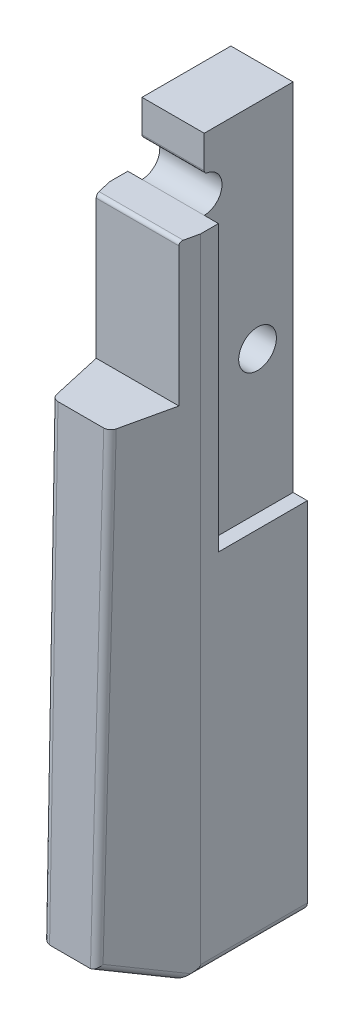
from build123d import *

# Parameters (mm, degrees)
SKETCH1_W           = 100
SKETCH1_H           = 11.75
BOSS_EXTRUDE1_DEPTH = 17.5
SKETCH5_R           = 2.65
CUT_EXTRUDE2_DEPTH  = 103.197419243
SKETCH4_W           = 50
SKETCH4_H           = 12.5
SKETCH4_R           = 2.65
CUT_EXTRUDE3_DEPTH  = 1.5
BOSS_EXTRUDE3_DEPTH = 0.5
BOSS_EXTRUDE2_DEPTH = 12.75
CUT_EXTRUDE4_DEPTH  = 105.302744451
FILLET4_R           = 1
FILLET3_R           = 1
CUT_EXTRUDE5_REACH  = 100.641
CUT_EXTRUDE7_REACH  = 106.363
SKETCH13_W          = 5
SKETCH13_H          = 5
FILLET5_R           = 0.5
CUT_EXTRUDE6_DEPTH  = 5
CHAMFER1_SIZE       = 3
CHAMFER1_SIZE2      = 0.262465991
FILLET6_R           = 1


with BuildPart() as part:
    # Sketch1 → Boss-Extrude1 (new body)
    with BuildSketch(Plane(origin=(0, 0, 0), x_dir=(0, 1, 0), z_dir=(0, 0, 1))):
        with Locations((50, 5.875)):
            Rectangle(SKETCH1_W, SKETCH1_H)
    extrude(amount=BOSS_EXTRUDE1_DEPTH)

    # Sketch5 → Cut-Extrude2 (cut, through all)
    with BuildSketch(Plane.YZ):
        with Locations(Location((70, 5, 0), (0, 0, 270))):
            Circle(SKETCH5_R)
    extrude(amount=-CUT_EXTRUDE2_DEPTH, mode=Mode.SUBTRACT)

    # Sketch4 → Cut-Extrude3 (cut)
    with BuildSketch(Plane.YZ):
        with Locations((75, 6.25)):
            Rectangle(SKETCH4_W, SKETCH4_H)
        with Locations(Location((70, 5, 0), (0, 0, 270))):
            Circle(SKETCH4_R, mode=Mode.SUBTRACT)
    cut_extrude3 = extrude(amount=-CUT_EXTRUDE3_DEPTH, mode=Mode.SUBTRACT)

    # Mirror1: Cut-Extrude3 across plane
    add(cut_extrude3.mirror(Plane(origin=(-5.875, 0, 0), x_dir=(0, 0, 1), z_dir=(1, 0, 0))), mode=Mode.SUBTRACT)

    # Sketch9 → Boss-Extrude3 (add)
    with BuildSketch(Plane.YZ):
        Polygon((0, 17.5), (50, 17.5), (100, 17.5), (100, 12.5), (50, 12.5), (50, 0), (0, 0), align=None)
    boss_extrude3 = extrude(amount=BOSS_EXTRUDE3_DEPTH)

    # Mirror4: Boss-Extrude3 across plane
    add(boss_extrude3.mirror(Plane(origin=(-5.875, 0, 0), x_dir=(0, 0, 1), z_dir=(1, 0, 0))))

    # Sketch6 → Boss-Extrude2 (add)
    with BuildSketch(Plane.YZ.offset(0.5)):
        Polygon((4.75, 27), (0, 17.5), (70, 17.5), (70, 25.469208211), align=None)
    extrude(amount=-BOSS_EXTRUDE2_DEPTH)

    # Sketch7 → Cut-Extrude4 (cut, symmetric)
    with BuildSketch(Plane(origin=(0, 100, 0), x_dir=(-1, 0, 0), z_dir=(0, 1, 0))):
        Polygon((-15.35357036, -50.966517558), (-0.5, 15), (2.202019917, 27), (17.055590277, 92.966517558), (-114.877444838, 122.673658277), (-147.286605475, -21.259376838), align=None)
    cut_extrude4 = extrude(amount=CUT_EXTRUDE4_DEPTH, both=True, mode=Mode.SUBTRACT)

    # Mirror3: Cut-Extrude4 across plane
    add(cut_extrude4.mirror(Plane(origin=(-5.875, 0, 0), x_dir=(0, 0, 1), z_dir=(1, 0, 0))), mode=Mode.SUBTRACT)

    # Fillet4
    fillet4_edges = [part.edges().sort_by_distance(p)[0] for p in [
        (-2.029677005, 37.375, 26.234604106),
        (-1.132470367, 2.375, 22.25),
        (-5.875, 0, 17.5),
        (-9.720322995, 37.375, 26.234604106),
        (-10.617529633, 2.375, 22.25),
    ]]
    fillet(fillet4_edges, radius=FILLET4_R)

    # Fillet3
    # the kernel refuses this fillet: 1 mm, written as the material it takes off along each edge
    with BuildSketch(Plane(origin=(-12.25, 0, -2.5), x_dir=(1, 0, 0), z_dir=(0, 0, 1))) as fillet3_piece_1:
        with BuildLine():
            CenterArc((FILLET3_R, FILLET3_R), FILLET3_R, 180, 90)
            Line((0, FILLET3_R), (0, 0))
            Line((0, 0), (FILLET3_R, 0))
        make_face()
    extrude(amount=20, mode=Mode.SUBTRACT)
    with BuildSketch(Plane(origin=(0.5, 0, -2.5), x_dir=(-1, 0, 0), z_dir=(0, 0, 1))) as fillet3_piece_2:
        with BuildLine():
            CenterArc((FILLET3_R, -FILLET3_R), FILLET3_R, 90, 90)
            Line((0, -FILLET3_R), (0, 0))
            Line((0, 0), (FILLET3_R, 0))
        make_face()
    extrude(amount=20, mode=Mode.SUBTRACT)

    # Sketch11 → Cut-Extrude5 (cut, up to next)
    with BuildSketch(Plane(origin=(0.5, 95.880843205, 19.349640389), x_dir=(0, 0, 1), z_dir=(1, 0, 0)), mode=Mode.PRIVATE) as cut_extrude5_sk1:
        with BuildLine():
            Line((-6.849640389, 0.880843205), (-1.849640389, 0.880843205))
            ThreePointArc((-1.849640389, 0.880843205), (0.650359611, 3.380843205), (-1.849640389, 5.880843205))
            Line((-1.849640389, 5.880843205), (-6.849640389, 5.880843205))
            ThreePointArc((-6.849640389, 5.880843205), (-9.349640389, 3.380843205), (-6.849640389, 0.880843205))
        make_face()
    cut_extrude5_tool1 = extrude(cut_extrude5_sk1.sketch, amount=-CUT_EXTRUDE5_REACH, mode=Mode.PRIVATE) & part.part
    add(cut_extrude5_tool1.solids().sort_by_distance((0.5, 92.5, 15))[0], mode=Mode.SUBTRACT)

    # Sketch13 → Cut-Extrude7 (cut, up to next)
    with BuildSketch(Plane.YZ.offset(0.5), mode=Mode.PRIVATE) as cut_extrude7_sk1:
        with Locations((97.5, 15)):
            Rectangle(SKETCH13_W, SKETCH13_H)
    cut_extrude7_tool1 = extrude(cut_extrude7_sk1.sketch, amount=-CUT_EXTRUDE7_REACH, mode=Mode.PRIVATE) & part.part
    add(cut_extrude7_tool1.solids().sort_by_distance((0.5, 97.5, 15))[0], mode=Mode.SUBTRACT)

    # Fillet5
    fillet5_edges = [part.edges().sort_by_distance(p)[0] for p in [
        (-5.875, 95, 12.5),
        (-5.875, 90, 17.5),
    ]]
    fillet(fillet5_edges, radius=FILLET5_R)

    # Sketch12 → Cut-Extrude6 (cut)
    with BuildSketch(Plane(origin=(0, 0, 0), x_dir=(1, 0, 0), z_dir=(0, 0, -1))):
        with BuildLine():
            ThreePointArc((-2.675, -13.5), (-3.6122583, -11.2372583), (-5.875, -10.3))
            Line((-5.875, -10.3), (-5.875, -10.55))
            ThreePointArc((-5.875, -10.55), (-3.789034995, -11.414034995), (-2.925, -13.5))
            Line((-2.925, -13.5), (-2.675, -13.5))
        make_face()
        with BuildLine():
            Line((-5.875, -10.55), (-5.875, -10.3))
            ThreePointArc((-5.875, -10.3), (-8.1377417, -15.7627417), (-2.675, -13.5))
            Line((-2.675, -13.5), (-2.925, -13.5))
            ThreePointArc((-2.925, -13.5), (-7.960965005, -15.585965005), (-5.875, -10.55))
        make_face()
    extrude(amount=-CUT_EXTRUDE6_DEPTH, mode=Mode.SUBTRACT)

    # Chamfer1
    chamfer1_edges = [part.edges().sort_by_distance(p)[0] for p in [
        (-5.875, 16.45, 0),
    ]]
    chamfer1_side = [part.faces().sort_by_distance(p)[0] for p in [
        (-5.875, 16.45, 2.5),
    ]]
    chamfer(chamfer1_edges, length=CHAMFER1_SIZE, length2=CHAMFER1_SIZE2, reference=chamfer1_side[0])

    # Fillet6
    fillet6_edges = [part.edges().sort_by_distance(p)[0] for p in [
        (-5.875, 16.187534009, 0),
    ]]
    fillet(fillet6_edges, radius=FILLET6_R)


solid = part.part
